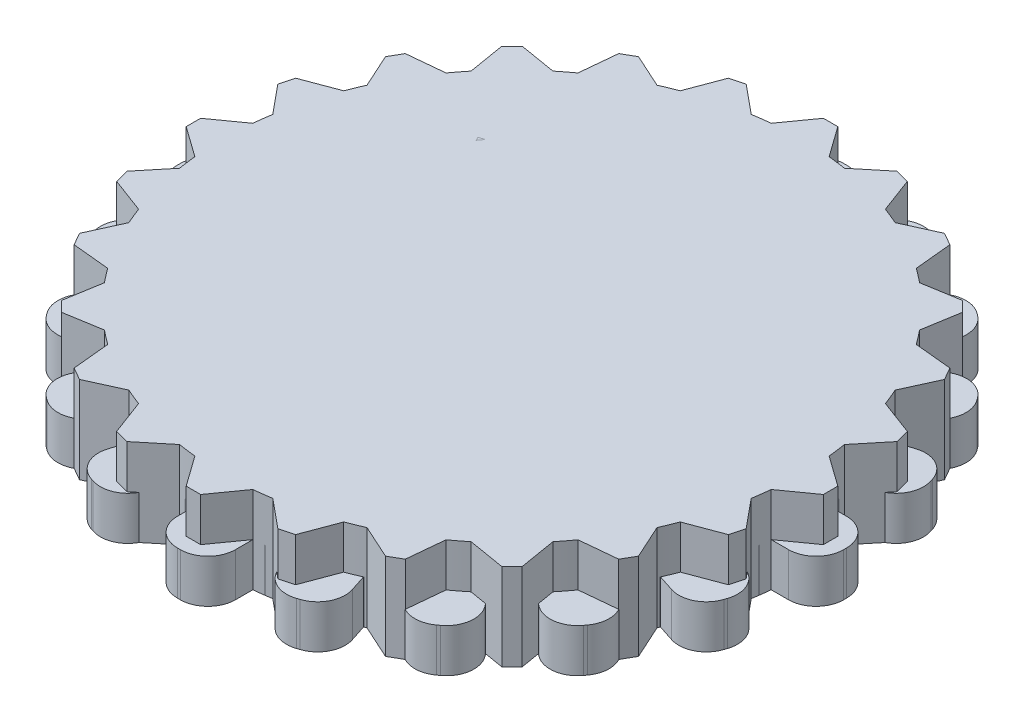
from build123d import *

# Parameters (mm, degrees)
BOSS_EXTRUDE3_DEPTH = 3
BOSS_EXTRUDE5_DEPTH = 6
SKETCH1_W           = 5
SKETCH1_H           = 3
BOSS_EXTRUDE6_DEPTH = 6


with BuildPart() as part:
    # Sketch2 → Boss-Extrude3 (new body)
    with BuildSketch(Plane(origin=(0, 0, 0), x_dir=(1, 0, 0), z_dir=(0, 1, 0))):
        with BuildLine():
            Line((-23, 0.1), (-23, -0.1))
            ThreePointArc((-23, -0.1), (-22.443502884, -1.443502884), (-21.1, -2))
            Line((-21.1, -2), (-19.899748742, -2))
            ThreePointArc((-19.899748742, -2), (-19.753766812, -3.128689301), (-19.543819703, -4.247247513))
            Line((-19.543819703, -4.247247513), (-20.685326483, -4.618145549))
            ThreePointArc((-20.685326483, -4.618145549), (-21.791106589, -5.56257098), (-21.905201574, -7.012285219))
            Line((-21.905201574, -7.012285219), (-21.843398175, -7.202496522))
            ThreePointArc((-21.843398175, -7.202496522), (-20.898972744, -8.308276629), (-19.449258505, -8.422371614))
            Line((-19.449258505, -8.422371614), (-18.307751725, -8.051473578))
            ThreePointArc((-18.307751725, -8.051473578), (-17.820130484, -9.079809995), (-17.274805421, -10.078744846))
            Line((-17.274805421, -10.078744846), (-18.245829086, -10.784234835))
            ThreePointArc((-18.245829086, -10.784234835), (-19.005644954, -12.02414164), (-18.666169396, -13.438159103))
            Line((-18.666169396, -13.438159103), (-18.548612345, -13.599962502))
            ThreePointArc((-18.548612345, -13.599962502), (-17.30870554, -14.35977837), (-15.894688077, -14.020302812))
            Line((-15.894688077, -14.020302812), (-14.923664412, -13.314812824))
            ThreePointArc((-14.923664412, -13.314812824), (-14.142135624, -14.142135624), (-13.314812824, -14.923664412))
            Line((-13.314812824, -14.923664412), (-14.020302812, -15.894688077))
            ThreePointArc((-14.020302812, -15.894688077), (-14.35977837, -17.30870554), (-13.599962502, -18.548612345))
            Line((-13.599962502, -18.548612345), (-13.438159103, -18.666169396))
            ThreePointArc((-13.438159103, -18.666169396), (-12.02414164, -19.005644954), (-10.784234835, -18.245829086))
            Line((-10.784234835, -18.245829086), (-10.078744846, -17.274805421))
            ThreePointArc((-10.078744846, -17.274805421), (-9.079809995, -17.820130484), (-8.051473578, -18.307751725))
            Line((-8.051473578, -18.307751725), (-8.422371614, -19.449258505))
            ThreePointArc((-8.422371614, -19.449258505), (-8.308276629, -20.898972744), (-7.202496522, -21.843398175))
            Line((-7.202496522, -21.843398175), (-7.012285219, -21.905201574))
            ThreePointArc((-7.012285219, -21.905201574), (-5.56257098, -21.791106589), (-4.618145549, -20.685326483))
            Line((-4.618145549, -20.685326483), (-4.247247513, -19.543819703))
            ThreePointArc((-4.247247513, -19.543819703), (-3.128689301, -19.753766812), (-2, -19.899748742))
            Line((-2, -19.899748742), (-2, -21.1))
            ThreePointArc((-2, -21.1), (-1.443502884, -22.443502884), (-0.1, -23))
            Line((-0.1, -23), (0.1, -23))
            ThreePointArc((0.1, -23), (1.443502884, -22.443502884), (2, -21.1))
            Line((2, -21.1), (2, -19.899748742))
            ThreePointArc((2, -19.899748742), (3.128689301, -19.753766812), (4.247247513, -19.543819703))
            Line((4.247247513, -19.543819703), (4.618145549, -20.685326483))
            ThreePointArc((4.618145549, -20.685326483), (5.56257098, -21.791106589), (7.012285219, -21.905201574))
            Line((7.012285219, -21.905201574), (7.202496522, -21.843398175))
            ThreePointArc((7.202496522, -21.843398175), (8.308276629, -20.898972744), (8.422371614, -19.449258505))
            Line((8.422371614, -19.449258505), (8.051473578, -18.307751725))
            ThreePointArc((8.051473578, -18.307751725), (9.079809995, -17.820130484), (10.078744846, -17.274805421))
            Line((10.078744846, -17.274805421), (10.784234835, -18.245829086))
            ThreePointArc((10.784234835, -18.245829086), (12.02414164, -19.005644954), (13.438159103, -18.666169396))
            Line((13.438159103, -18.666169396), (13.599962502, -18.548612345))
            ThreePointArc((13.599962502, -18.548612345), (14.35977837, -17.30870554), (14.020302812, -15.894688077))
            Line((14.020302812, -15.894688077), (13.314812824, -14.923664412))
            ThreePointArc((13.314812824, -14.923664412), (14.142135624, -14.142135624), (14.923664412, -13.314812824))
            Line((14.923664412, -13.314812824), (15.894688077, -14.020302812))
            ThreePointArc((15.894688077, -14.020302812), (17.30870554, -14.35977837), (18.548612345, -13.599962502))
            Line((18.548612345, -13.599962502), (18.666169396, -13.438159103))
            ThreePointArc((18.666169396, -13.438159103), (19.005644954, -12.02414164), (18.245829086, -10.784234835))
            Line((18.245829086, -10.784234835), (17.274805421, -10.078744846))
            ThreePointArc((17.274805421, -10.078744846), (17.820130484, -9.079809995), (18.307751725, -8.051473578))
            Line((18.307751725, -8.051473578), (19.449258505, -8.422371614))
            ThreePointArc((19.449258505, -8.422371614), (20.898972744, -8.308276629), (21.843398175, -7.202496522))
            Line((21.843398175, -7.202496522), (21.905201574, -7.012285219))
            ThreePointArc((21.905201574, -7.012285219), (21.791106589, -5.56257098), (20.685326483, -4.618145549))
            Line((20.685326483, -4.618145549), (19.543819703, -4.247247513))
            ThreePointArc((19.543819703, -4.247247513), (19.753766812, -3.128689301), (19.899748742, -2))
            Line((19.899748742, -2), (21.1, -2))
            ThreePointArc((21.1, -2), (22.443502884, -1.443502884), (23, -0.1))
            Line((23, -0.1), (23, 0.1))
            ThreePointArc((23, 0.1), (22.443502884, 1.443502884), (21.1, 2))
            Line((21.1, 2), (19.899748742, 2))
            ThreePointArc((19.899748742, 2), (19.753766812, 3.128689301), (19.543819703, 4.247247513))
            Line((19.543819703, 4.247247513), (20.685326483, 4.618145549))
            ThreePointArc((20.685326483, 4.618145549), (21.791106589, 5.56257098), (21.905201574, 7.012285219))
            Line((21.905201574, 7.012285219), (21.843398175, 7.202496522))
            ThreePointArc((21.843398175, 7.202496522), (20.898972744, 8.308276629), (19.449258505, 8.422371614))
            Line((19.449258505, 8.422371614), (18.307751725, 8.051473578))
            ThreePointArc((18.307751725, 8.051473578), (17.820130484, 9.079809995), (17.274805421, 10.078744846))
            Line((17.274805421, 10.078744846), (18.245829086, 10.784234835))
            ThreePointArc((18.245829086, 10.784234835), (19.005644954, 12.02414164), (18.666169396, 13.438159103))
            Line((18.666169396, 13.438159103), (18.548612345, 13.599962502))
            ThreePointArc((18.548612345, 13.599962502), (17.30870554, 14.35977837), (15.894688077, 14.020302812))
            Line((15.894688077, 14.020302812), (14.923664412, 13.314812824))
            ThreePointArc((14.923664412, 13.314812824), (14.142135624, 14.142135624), (13.314812824, 14.923664412))
            Line((13.314812824, 14.923664412), (14.020302812, 15.894688077))
            ThreePointArc((14.020302812, 15.894688077), (14.35977837, 17.30870554), (13.599962502, 18.548612345))
            Line((13.599962502, 18.548612345), (13.438159103, 18.666169396))
            ThreePointArc((13.438159103, 18.666169396), (12.02414164, 19.005644954), (10.784234835, 18.245829086))
            Line((10.784234835, 18.245829086), (10.078744846, 17.274805421))
            ThreePointArc((10.078744846, 17.274805421), (9.079809995, 17.820130484), (8.051473578, 18.307751725))
            Line((8.051473578, 18.307751725), (8.422371614, 19.449258505))
            ThreePointArc((8.422371614, 19.449258505), (8.308276629, 20.898972744), (7.202496522, 21.843398175))
            Line((7.202496522, 21.843398175), (7.012285219, 21.905201574))
            ThreePointArc((7.012285219, 21.905201574), (5.56257098, 21.791106589), (4.618145549, 20.685326483))
            Line((4.618145549, 20.685326483), (4.247247513, 19.543819703))
            ThreePointArc((4.247247513, 19.543819703), (3.128689301, 19.753766812), (2, 19.899748742))
            Line((2, 19.899748742), (2, 21.1))
            ThreePointArc((2, 21.1), (1.443502884, 22.443502884), (0.1, 23))
            Line((0.1, 23), (-0.1, 23))
            ThreePointArc((-0.1, 23), (-1.443502884, 22.443502884), (-2, 21.1))
            Line((-2, 21.1), (-2, 19.899748742))
            ThreePointArc((-2, 19.899748742), (-3.128689301, 19.753766812), (-4.247247513, 19.543819703))
            Line((-4.247247513, 19.543819703), (-4.618145549, 20.685326483))
            ThreePointArc((-4.618145549, 20.685326483), (-5.56257098, 21.791106589), (-7.012285219, 21.905201574))
            Line((-7.012285219, 21.905201574), (-7.202496522, 21.843398175))
            ThreePointArc((-7.202496522, 21.843398175), (-8.308276629, 20.898972744), (-8.422371614, 19.449258505))
            Line((-8.422371614, 19.449258505), (-8.051473578, 18.307751725))
            ThreePointArc((-8.051473578, 18.307751725), (-9.079809995, 17.820130484), (-10.078744846, 17.274805421))
            Line((-10.078744846, 17.274805421), (-10.784234835, 18.245829086))
            ThreePointArc((-10.784234835, 18.245829086), (-12.02414164, 19.005644954), (-13.438159103, 18.666169396))
            Line((-13.438159103, 18.666169396), (-13.599962502, 18.548612345))
            ThreePointArc((-13.599962502, 18.548612345), (-14.35977837, 17.30870554), (-14.020302812, 15.894688077))
            Line((-14.020302812, 15.894688077), (-13.314812824, 14.923664412))
            ThreePointArc((-13.314812824, 14.923664412), (-14.142135624, 14.142135624), (-14.923664412, 13.314812824))
            Line((-14.923664412, 13.314812824), (-15.894688077, 14.020302812))
            ThreePointArc((-15.894688077, 14.020302812), (-17.30870554, 14.35977837), (-18.548612345, 13.599962502))
            Line((-18.548612345, 13.599962502), (-18.666169396, 13.438159103))
            ThreePointArc((-18.666169396, 13.438159103), (-19.005644954, 12.02414164), (-18.245829086, 10.784234835))
            Line((-18.245829086, 10.784234835), (-17.274805421, 10.078744846))
            ThreePointArc((-17.274805421, 10.078744846), (-17.820130484, 9.079809995), (-18.307751725, 8.051473578))
            Line((-18.307751725, 8.051473578), (-19.449258505, 8.422371614))
            ThreePointArc((-19.449258505, 8.422371614), (-20.898972744, 8.308276629), (-21.843398175, 7.202496522))
            Line((-21.843398175, 7.202496522), (-21.905201574, 7.012285219))
            ThreePointArc((-21.905201574, 7.012285219), (-21.791106589, 5.56257098), (-20.685326483, 4.618145549))
            Line((-20.685326483, 4.618145549), (-19.543819703, 4.247247513))
            ThreePointArc((-19.543819703, 4.247247513), (-19.753766812, 3.128689301), (-19.899748742, 2))
            Line((-19.899748742, 2), (-21.1, 2))
            ThreePointArc((-21.1, 2), (-22.443502884, 1.443502884), (-23, 0.1))
        make_face()
    extrude(amount=BOSS_EXTRUDE3_DEPTH)


with BuildPart() as body_2:
    # Sketch3 → Boss-Extrude5 (new body)
    with BuildSketch(Plane(origin=(0, 0, 0), x_dir=(1, 0, 0), z_dir=(0, 1, 0))):
        with BuildLine():
            Line((-22, 0.5), (-22, -0.5))
            Line((-22, -0.5), (-19.899748742, -2))
            ThreePointArc((-19.899748742, -2), (-19.828897227, -2.610523844), (-19.739319337, -3.218582315))
            Line((-19.739319337, -3.218582315), (-21.379777701, -5.211056079))
            Line((-21.379777701, -5.211056079), (-21.120958656, -6.176981905))
            Line((-21.120958656, -6.176981905), (-18.704043156, -7.08228562))
            ThreePointArc((-18.704043156, -7.08228562), (-18.47759065, -7.653668647), (-18.23368794, -8.217823563))
            Line((-18.23368794, -8.217823563), (-19.302558883, -10.566987298))
            Line((-19.302558883, -10.566987298), (-18.802558883, -11.433012702))
            Line((-18.802558883, -11.433012702), (-16.23368794, -11.681925179))
            ThreePointArc((-16.23368794, -11.681925179), (-15.867066806, -12.17522858), (-15.485460842, -12.657033717))
            Line((-15.485460842, -12.657033717), (-15.909902577, -15.202795796))
            Line((-15.909902577, -15.202795796), (-15.202795796, -15.909902577))
            Line((-15.202795796, -15.909902577), (-12.657033717, -15.485460842))
            ThreePointArc((-12.657033717, -15.485460842), (-12.17522858, -15.867066806), (-11.681925179, -16.23368794))
            Line((-11.681925179, -16.23368794), (-11.433012702, -18.802558883))
            Line((-11.433012702, -18.802558883), (-10.566987298, -19.302558883))
            Line((-10.566987298, -19.302558883), (-8.217823563, -18.23368794))
            ThreePointArc((-8.217823563, -18.23368794), (-7.653668647, -18.47759065), (-7.08228562, -18.704043156))
            Line((-7.08228562, -18.704043156), (-6.176981905, -21.120958656))
            Line((-6.176981905, -21.120958656), (-5.211056079, -21.379777701))
            Line((-5.211056079, -21.379777701), (-3.218582315, -19.739319337))
            ThreePointArc((-3.218582315, -19.739319337), (-2.610523844, -19.828897227), (-2, -19.899748742))
            Line((-2, -19.899748742), (-0.5, -22))
            Line((-0.5, -22), (0.5, -22))
            Line((0.5, -22), (2, -19.899748742))
            ThreePointArc((2, -19.899748742), (2.610523844, -19.828897227), (3.218582315, -19.739319337))
            Line((3.218582315, -19.739319337), (5.211056079, -21.379777701))
            Line((5.211056079, -21.379777701), (6.176981905, -21.120958656))
            Line((6.176981905, -21.120958656), (7.08228562, -18.704043156))
            ThreePointArc((7.08228562, -18.704043156), (7.653668647, -18.47759065), (8.217823563, -18.23368794))
            Line((8.217823563, -18.23368794), (10.566987298, -19.302558883))
            Line((10.566987298, -19.302558883), (11.433012702, -18.802558883))
            Line((11.433012702, -18.802558883), (11.681925179, -16.23368794))
            ThreePointArc((11.681925179, -16.23368794), (12.17522858, -15.867066806), (12.657033717, -15.485460842))
            Line((12.657033717, -15.485460842), (15.202795796, -15.909902577))
            Line((15.202795796, -15.909902577), (15.909902577, -15.202795796))
            Line((15.909902577, -15.202795796), (15.485460842, -12.657033717))
            ThreePointArc((15.485460842, -12.657033717), (15.867066806, -12.17522858), (16.23368794, -11.681925179))
            Line((16.23368794, -11.681925179), (18.802558883, -11.433012702))
            Line((18.802558883, -11.433012702), (19.302558883, -10.566987298))
            Line((19.302558883, -10.566987298), (18.23368794, -8.217823563))
            ThreePointArc((18.23368794, -8.217823563), (18.47759065, -7.653668647), (18.704043156, -7.08228562))
            Line((18.704043156, -7.08228562), (21.120958656, -6.176981905))
            Line((21.120958656, -6.176981905), (21.379777701, -5.211056079))
            Line((21.379777701, -5.211056079), (19.739319337, -3.218582315))
            ThreePointArc((19.739319337, -3.218582315), (19.828897227, -2.610523844), (19.899748742, -2))
            Line((19.899748742, -2), (22, -0.5))
            Line((22, -0.5), (22, 0.5))
            Line((22, 0.5), (19.899748742, 2))
            ThreePointArc((19.899748742, 2), (19.828897227, 2.610523844), (19.739319337, 3.218582315))
            Line((19.739319337, 3.218582315), (21.379777701, 5.211056079))
            Line((21.379777701, 5.211056079), (21.120958656, 6.176981905))
            Line((21.120958656, 6.176981905), (18.704043156, 7.08228562))
            ThreePointArc((18.704043156, 7.08228562), (18.47759065, 7.653668647), (18.23368794, 8.217823563))
            Line((18.23368794, 8.217823563), (19.302558883, 10.566987298))
            Line((19.302558883, 10.566987298), (18.802558883, 11.433012702))
            Line((18.802558883, 11.433012702), (16.23368794, 11.681925179))
            ThreePointArc((16.23368794, 11.681925179), (15.867066806, 12.17522858), (15.485460842, 12.657033717))
            Line((15.485460842, 12.657033717), (15.909902577, 15.202795796))
            Line((15.909902577, 15.202795796), (15.202795796, 15.909902577))
            Line((15.202795796, 15.909902577), (12.657033717, 15.485460842))
            ThreePointArc((12.657033717, 15.485460842), (12.17522858, 15.867066806), (11.681925179, 16.23368794))
            Line((11.681925179, 16.23368794), (11.433012702, 18.802558883))
            Line((11.433012702, 18.802558883), (10.566987298, 19.302558883))
            Line((10.566987298, 19.302558883), (8.217823563, 18.23368794))
            ThreePointArc((8.217823563, 18.23368794), (7.653668647, 18.47759065), (7.08228562, 18.704043156))
            Line((7.08228562, 18.704043156), (6.176981905, 21.120958656))
            Line((6.176981905, 21.120958656), (5.211056079, 21.379777701))
            Line((5.211056079, 21.379777701), (3.218582315, 19.739319337))
            ThreePointArc((3.218582315, 19.739319337), (2.610523844, 19.828897227), (2, 19.899748742))
            Line((2, 19.899748742), (0.5, 22))
            Line((0.5, 22), (-0.5, 22))
            Line((-0.5, 22), (-2, 19.899748742))
            ThreePointArc((-2, 19.899748742), (-2.610523844, 19.828897227), (-3.218582315, 19.739319337))
            Line((-3.218582315, 19.739319337), (-5.211056079, 21.379777701))
            Line((-5.211056079, 21.379777701), (-6.176981905, 21.120958656))
            Line((-6.176981905, 21.120958656), (-7.08228562, 18.704043156))
            ThreePointArc((-7.08228562, 18.704043156), (-7.653668647, 18.47759065), (-8.217823563, 18.23368794))
            Line((-8.217823563, 18.23368794), (-10.566987298, 19.302558883))
            Line((-10.566987298, 19.302558883), (-11.433012702, 18.802558883))
            Line((-11.433012702, 18.802558883), (-11.681925179, 16.23368794))
            ThreePointArc((-11.681925179, 16.23368794), (-12.17522858, 15.867066806), (-12.657033717, 15.485460842))
            Line((-12.657033717, 15.485460842), (-15.202795796, 15.909902577))
            Line((-15.202795796, 15.909902577), (-15.909902577, 15.202795796))
            Line((-15.909902577, 15.202795796), (-15.485460842, 12.657033717))
            ThreePointArc((-15.485460842, 12.657033717), (-15.867066806, 12.17522858), (-16.23368794, 11.681925179))
            Line((-16.23368794, 11.681925179), (-18.802558883, 11.433012702))
            Line((-18.802558883, 11.433012702), (-19.302558883, 10.566987298))
            Line((-19.302558883, 10.566987298), (-18.23368794, 8.217823563))
            ThreePointArc((-18.23368794, 8.217823563), (-18.47759065, 7.653668647), (-18.704043156, 7.08228562))
            Line((-18.704043156, 7.08228562), (-21.120958656, 6.176981905))
            Line((-21.120958656, 6.176981905), (-21.379777701, 5.211056079))
            Line((-21.379777701, 5.211056079), (-19.739319337, 3.218582315))
            ThreePointArc((-19.739319337, 3.218582315), (-19.828897227, 2.610523844), (-19.899748742, 2))
            Line((-19.899748742, 2), (-22, 0.5))
        make_face()
    extrude(amount=BOSS_EXTRUDE5_DEPTH)


with BuildPart() as body_3:
    # Sketch1 → Boss-Extrude6 (new body)
    with BuildSketch(Plane(origin=(0, 0, 0), x_dir=(1, 0, 0), z_dir=(0, 1, 0))):
        with BuildLine():
            Line((-1.142396869, 15.366895677), (-0.142396869, 15.366895677))
            Line((-0.142396869, 15.366895677), (1.357603131, 13.164854648))
            ThreePointArc((1.357603131, 13.164854648), (1.945793582, 13.026153939), (2.524531809, 12.852177051))
            Line((2.524531809, 12.852177051), (4.924590429, 14.009200522))
            Line((4.924590429, 14.009200522), (5.790615833, 13.509200522))
            Line((5.790615833, 13.509200522), (5.988633424, 10.852177051))
            ThreePointArc((5.988633424, 10.852177051), (6.428670943, 10.437963488), (6.842884505, 9.99792597))
            Line((6.842884505, 9.99792597), (9.499907976, 9.799908378))
            Line((9.499907976, 9.799908378), (9.999907976, 8.933882975))
            Line((9.999907976, 8.933882975), (8.842884505, 6.533824355))
            ThreePointArc((8.842884505, 6.533824355), (9.016861394, 5.955086128), (9.155562102, 5.366895677))
            Line((9.155562102, 5.366895677), (11.357603131, 3.866895677))
            Line((11.357603131, 3.866895677), (11.357603131, 2.866895677))
            Line((11.357603131, 2.866895677), (9.155562102, 1.366895677))
            ThreePointArc((9.155562102, 1.366895677), (9.016861394, 0.778705226), (8.842884505, 0.199966999))
            Line((8.842884505, 0.199966999), (9.999907976, -2.200091622))
            Line((9.999907976, -2.200091622), (9.499907976, -3.066117025))
            Line((9.499907976, -3.066117025), (6.842884505, -3.264134617))
            ThreePointArc((6.842884505, -3.264134617), (6.428670943, -3.704172135), (5.988633424, -4.118385698))
            Line((5.988633424, -4.118385698), (5.790615833, -6.775409169))
            Line((5.790615833, -6.775409169), (4.924590429, -7.275409169))
            Line((4.924590429, -7.275409169), (2.524531809, -6.118385698))
            ThreePointArc((2.524531809, -6.118385698), (1.945793582, -6.292362586), (1.357603131, -6.431063295))
            Line((1.357603131, -6.431063295), (-0.142396869, -8.633104323))
            Line((-0.142396869, -8.633104323), (-1.142396869, -8.633104323))
            Line((-1.142396869, -8.633104323), (-2.642396869, -6.431063295))
            ThreePointArc((-2.642396869, -6.431063295), (-3.23058732, -6.292362586), (-3.809325547, -6.118385698))
            Line((-3.809325547, -6.118385698), (-6.209384167, -7.275409169))
            Line((-6.209384167, -7.275409169), (-7.075409571, -6.775409169))
            Line((-7.075409571, -6.775409169), (-7.273427162, -4.118385698))
            ThreePointArc((-7.273427162, -4.118385698), (-7.713464681, -3.704172135), (-8.127678243, -3.264134617))
            Line((-8.127678243, -3.264134617), (-10.784701714, -3.066117025))
            Line((-10.784701714, -3.066117025), (-11.284701714, -2.200091622))
            Line((-11.284701714, -2.200091622), (-10.127678243, 0.199966999))
            ThreePointArc((-10.127678243, 0.199966999), (-10.301655132, 0.778705226), (-10.44035584, 1.366895677))
            Line((-10.44035584, 1.366895677), (-12.642396869, 2.866895677))
            Line((-12.642396869, 2.866895677), (-12.642396869, 3.866895677))
            Line((-12.642396869, 3.866895677), (-10.44035584, 5.366895677))
            ThreePointArc((-10.44035584, 5.366895677), (-10.301655132, 5.955086128), (-10.127678243, 6.533824355))
            Line((-10.127678243, 6.533824355), (-11.284701714, 8.933882975))
            Line((-11.284701714, 8.933882975), (-10.784701714, 9.799908378))
            Line((-10.784701714, 9.799908378), (-8.127678243, 9.99792597))
            ThreePointArc((-8.127678243, 9.99792597), (-7.713464681, 10.437963488), (-7.273427162, 10.852177051))
            Line((-7.273427162, 10.852177051), (-7.075409571, 13.509200522))
            Line((-7.075409571, 13.509200522), (-6.209384167, 14.009200522))
            Line((-6.209384167, 14.009200522), (-3.809325547, 12.852177051))
            ThreePointArc((-3.809325547, 12.852177051), (-3.23058732, 13.026153939), (-2.642396869, 13.164854648))
            Line((-2.642396869, 13.164854648), (-1.142396869, 15.366895677))
        make_face()
        with Locations((-0.642396869, 3.366895677)):
            Rectangle(SKETCH1_W, SKETCH1_H, mode=Mode.SUBTRACT)
    extrude(amount=BOSS_EXTRUDE6_DEPTH)


solid = Compound([part.part, body_2.part, body_3.part])
